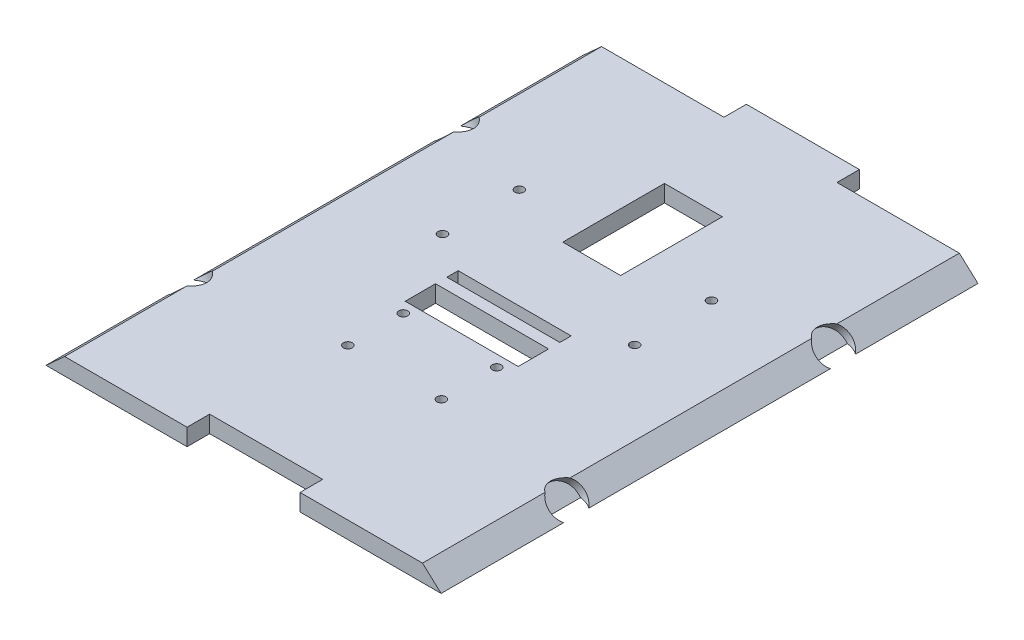
from build123d import *

# Parameters (mm, degrees)
BOSS_EXTRUDE1_DEPTH = 120.65
SKETCH3_W           = 25.4
SKETCH3_H           = 5.08
CUT_EXTRUDE1_DEPTH  = 129.616537105
SKETCH4_W           = 25.4
SKETCH4_H           = 5.08
BOSS_EXTRUDE3_DEPTH = 3.81
SKETCH5_R           = 1
SKETCH5_R_2         = 0.999998
SKETCH5_W           = 13
SKETCH5_H           = 22.86
SKETCH5_W_2         = 25.4
SKETCH5_H_2         = 2.54
SKETCH5_H_3         = 6.822527996
CUT_EXTRUDE2_DEPTH  = 129.616537105
SKETCH6_R           = 4
CUT_EXTRUDE3_DEPTH  = 2
SKETCH7_R           = 4
CUT_EXTRUDE4_DEPTH  = 2


with BuildPart() as part:
    # Sketch1 → Boss-Extrude1 (new body)
    with BuildSketch(Plane.XY):
        Polygon((-40.203883769, 5.937788296), (40.203883769, 5.937788296), (44.399042974, 2.127788296), (-44.399042974, 2.127788296), align=None)
    extrude(amount=BOSS_EXTRUDE1_DEPTH)

    # Sketch3 → Cut-Extrude1 (cut, through all)
    with BuildSketch(Plane.XZ.offset(-2.127788296)):
        with Locations((0, 118.11)):
            Rectangle(SKETCH3_W, SKETCH3_H)
    extrude(amount=-CUT_EXTRUDE1_DEPTH, mode=Mode.SUBTRACT)

    # Sketch4 → Boss-Extrude3 (add)
    with BuildSketch(Plane.XZ.offset(-2.127788296)):
        with Locations((0, -2.504739817)):
            Rectangle(SKETCH4_W, SKETCH4_H)
    extrude(amount=-BOSS_EXTRUDE3_DEPTH)

    # Sketch5 → Cut-Extrude2 (cut, through all)
    with BuildSketch(Plane(origin=(0, 2.127788296, 0), x_dir=(-1, 0, 0), z_dir=(0, -1, 0))):
        with Locations((21.59, -54.356)):
            Circle(SKETCH5_R)
        with Locations((21.59, -37.084)):
            Circle(SKETCH5_R)
        with Locations((-21.59, -37.084)):
            Circle(SKETCH5_R)
        with Locations((-21.59, -54.356)):
            Circle(SKETCH5_R)
        with Locations((-10.44215584, -74.203260183)):
            Circle(SKETCH5_R)
        with Locations((-10.44215584, -86.649260183)):
            Circle(SKETCH5_R)
        with Locations((10.55784416, -74.203260183)):
            Circle(SKETCH5_R)
        with Locations((10.55784416, -86.649260183)):
            Circle(SKETCH5_R)
        with Locations((-93.931058926, -72.649749874)):
            Circle(SKETCH5_R_2)
        with Locations((-93.931058926, -85.149749874)):
            Circle(SKETCH5_R)
        with Locations((-72.931058926, -72.649749874)):
            Circle(SKETCH5_R)
        with Locations((-72.931058926, -85.149749874)):
            Circle(SKETCH5_R)
        with Locations((-93.904836904, 5.641456719)):
            Circle(SKETCH5_R)
        with Locations((-53.184836904, 5.641456719)):
            Circle(SKETCH5_R)
        with Locations((-53.184836904, -9.358543281)):
            Circle(SKETCH5_R)
        with Locations((-93.904836904, -9.358543281)):
            Circle(SKETCH5_R)
        with Locations((0, -30.988)):
            Rectangle(SKETCH5_W, SKETCH5_H)
        with Locations((0, -60.995260183)):
            Rectangle(SKETCH5_W_2, SKETCH5_H_2)
        with Locations((0, -68.216524181)):
            Rectangle(SKETCH5_W_2, SKETCH5_H_3)
    extrude(amount=-CUT_EXTRUDE2_DEPTH, mode=Mode.SUBTRACT)

    # Sketch6 → Cut-Extrude3 (cut)
    with BuildSketch(Plane(origin=(-21.127225221, 23.263011377, 0), x_dir=(0.7402720771062569, 0.6723074087475075, 0), z_dir=(-0.6723074087475075, 0.7402720771062569, 0))):
        with Locations((-28.603318705, -30.353)):
            Circle(SKETCH6_R)
        with Locations((-28.603318705, -90.297)):
            Circle(SKETCH6_R)
    extrude(amount=-CUT_EXTRUDE3_DEPTH, mode=Mode.SUBTRACT)

    # Sketch7 → Cut-Extrude4 (cut)
    with BuildSketch(Plane(origin=(21.127225221, 23.263011377, 0), x_dir=(0.7402720771062569, -0.6723074087475075, 0), z_dir=(0.6723074087475075, 0.7402720771062569, 0))):
        with Locations((28.603318705, -90.297)):
            Circle(SKETCH7_R)
        with Locations((28.603318705, -30.353)):
            Circle(SKETCH7_R)
    extrude(amount=-CUT_EXTRUDE4_DEPTH, mode=Mode.SUBTRACT)


solid = part.part
